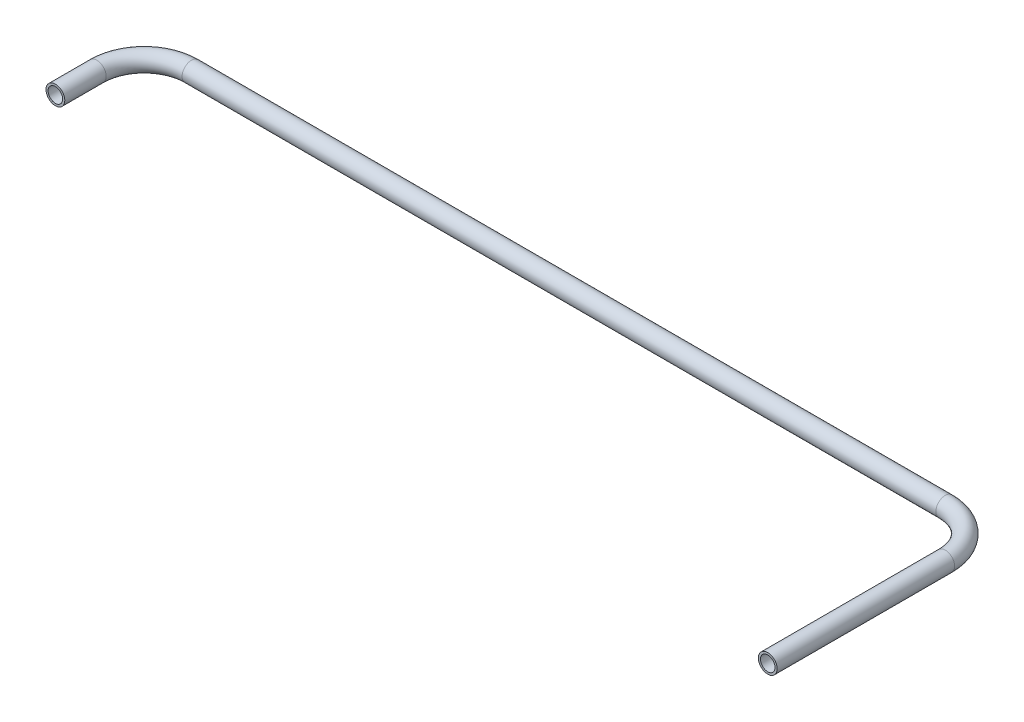
from build123d import *

# Parameters (mm, degrees)
SKETCH2_R   = 3.175
SKETCH2_R_2 = 2.4638


with BuildPart() as part:
    # Sweep-Thin1: sweep along a path in Sketch1
    with BuildLine(Plane(origin=(0, 0, 0), x_dir=(1, 0, 0), z_dir=(0, 1, 0))) as sweep_thin1_path:
        Line((0, 0), (0, 14))
        ThreePointArc((0, 14), (4.686291501, 25.313708499), (16, 30))
        Line((16, 30), (270.775, 30))
        ThreePointArc((270.775, 30), (282.088708499, 25.313708499), (286.775, 14))
        Line((286.775, 14), (286.775, -46))
    # Sketch2 → Sweep-Thin1 (sweep)
    with BuildSketch(Plane.XY):
        Circle(SKETCH2_R)
        Circle(SKETCH2_R_2, mode=Mode.SUBTRACT)
    sweep(path=sweep_thin1_path.line)


solid = part.part
